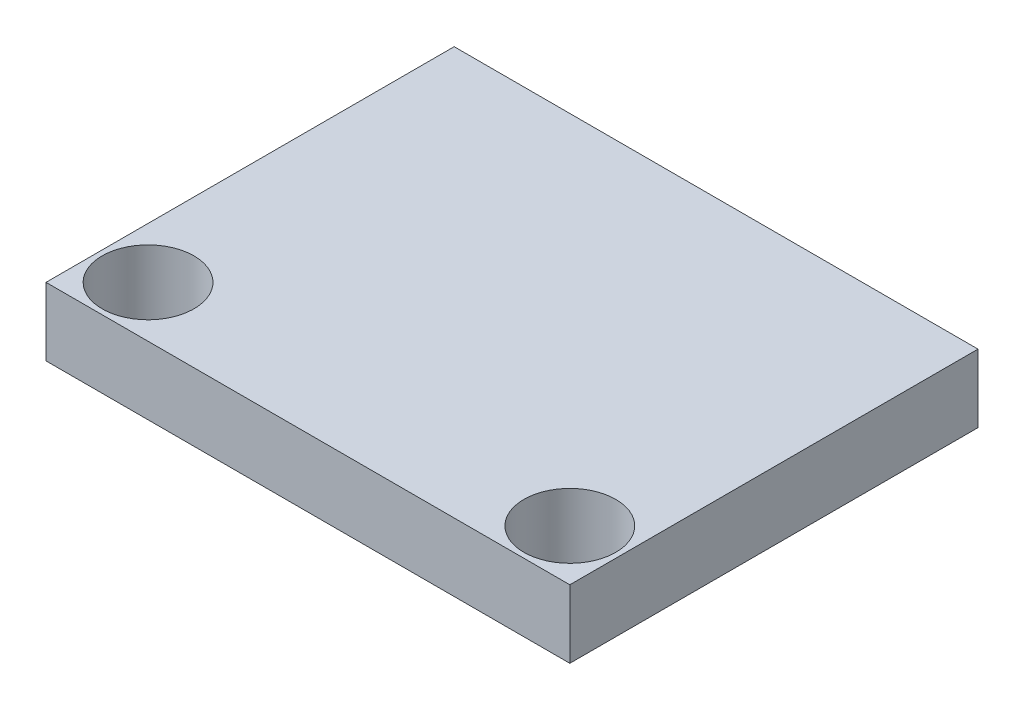
from build123d import *

# Parameters (mm, degrees)
BOSS_EXTRUDE1_OUTLINE_W = 154
BOSS_EXTRUDE1_OUTLINE_H = 120
BOSS_EXTRUDE1_DEPTH     = 20
SKETCH2_R               = 13.5
CUT_EXTRUDE3_DEPTH      = 144.975692393


# Read off the part's stored shape, not the designer's step: Boss-Extrude1
with BuildPart() as part:
    # Boss-Extrude1 outline → Boss-Extrude1 (new body)
    with BuildSketch(Plane(origin=(0, 0, 0), x_dir=(1, 0, 0), z_dir=(0, 1, 0))):
        with Locations((0, 60)):
            Rectangle(BOSS_EXTRUDE1_OUTLINE_W, BOSS_EXTRUDE1_OUTLINE_H)
    extrude(amount=BOSS_EXTRUDE1_DEPTH)

    # Sketch2 → Cut-Extrude3 (cut, through all)
    with BuildSketch(Plane.XZ):
        with Locations(Location((62, -15, 0), (0, 0, 270))):
            Circle(SKETCH2_R)
    cut_extrude3 = extrude(amount=-CUT_EXTRUDE3_DEPTH, mode=Mode.SUBTRACT)

    # Mirror1: Cut-Extrude3 across plane
    add(cut_extrude3.mirror(Plane(origin=(0, 0, 0), x_dir=(0, 0, 1), z_dir=(1, 0, 0))), mode=Mode.SUBTRACT)


solid = part.part
